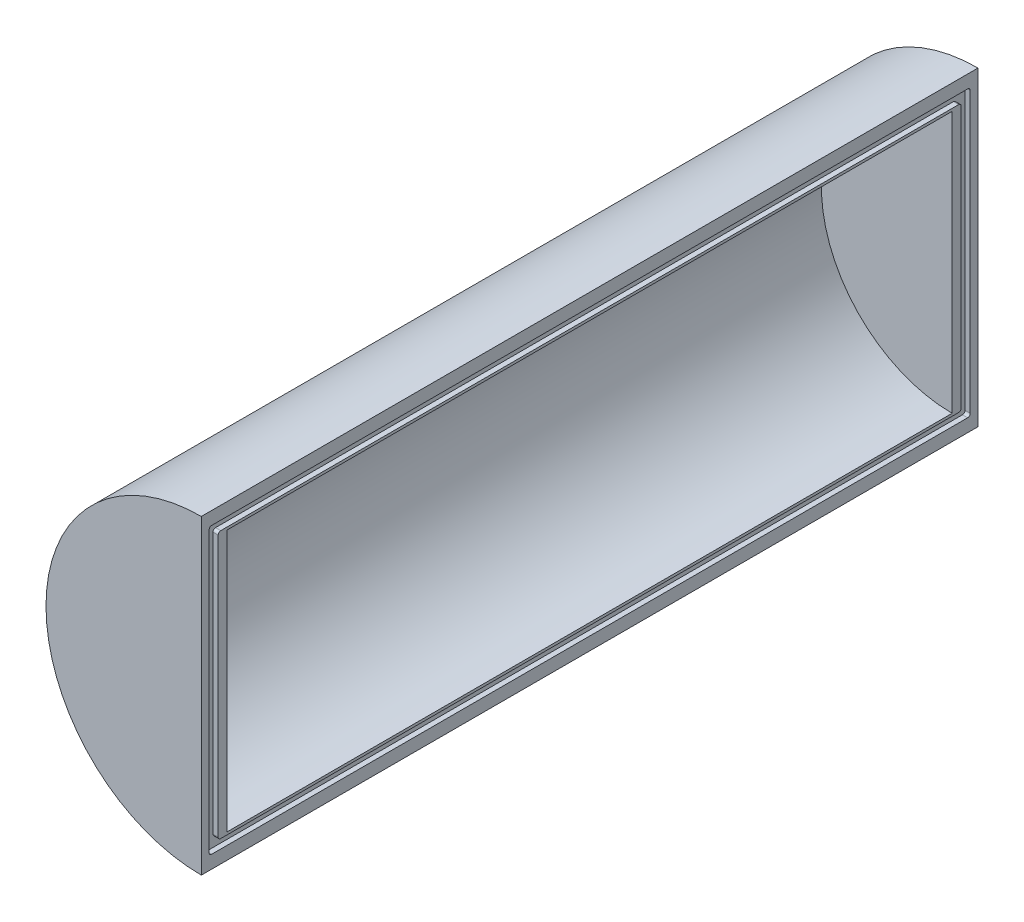
from build123d import *

# Parameters (mm, degrees)
BOSS_EXTRUDE1_DEPTH     = 280
BOSS_EXTRUDE3_START     = 10
BOSS_EXTRUDE3_DEPTH     = 10
CUT_EXTRUDE_THIN1_START = -2
CUT_EXTRUDE_THIN1_DEPTH = 2
FILLET6_R               = 1


# Read off the part's stored shape, not the designer's step: Cut-Extrude-Thin1
with BuildPart() as part:
    # Sketch1 → Boss-Extrude1 (new body)
    with BuildSketch(Plane.XY):
        with BuildLine():
            Line((0, 55), (-2, 55))
            Line((-2, 55), (-2, 51.5))
            Line((-2, 51.5), (0, 51.5))
            Line((0, 51.5), (0, 50.5))
            ThreePointArc((0, 50.5), (-50.5, 0), (0, -50.5))
            Line((0, -50.5), (0, -51.5))
            Line((0, -51.5), (-2, -51.5))
            Line((-2, -51.5), (-2, -55))
            Line((-2, -55), (0, -55))
            Line((0, -55), (0, -60))
            ThreePointArc((0, -60), (-60, 0), (0, 60))
            Line((0, 60), (0, 55))
        make_face()
    extrude(amount=-BOSS_EXTRUDE1_DEPTH)

    # Sketch7 → Boss-Extrude3 (add)
    with BuildSketch(Plane.XY.offset(BOSS_EXTRUDE3_START)):
        with BuildLine():
            Line((0, 60), (0, -60))
            ThreePointArc((0, -60), (-60, 0), (0, 60))
        make_face()
    boss_extrude3 = extrude(amount=-BOSS_EXTRUDE3_DEPTH)

    # Mirror1: Boss-Extrude3 across plane
    add(boss_extrude3.mirror(Plane.XY.offset(-140)))

    # Cut-Extrude-Thin1 outline → Cut-Extrude-Thin1 (cut)
    with BuildSketch(Plane(origin=(0, 0, 0), x_dir=(0, 0, -1), z_dir=(1, 0, 0)).offset(CUT_EXTRUDE_THIN1_START)):
        Polygon((0, 55), (-7, 55), (-7, -55), (0, -55), (0, -51.5), (-3.5, -51.5), (-3.5, 51.5), (0, 51.5), align=None)
    cut_extrude_thin1 = extrude(amount=CUT_EXTRUDE_THIN1_DEPTH, mode=Mode.SUBTRACT)

    # Mirror2: Cut-Extrude-Thin1 across plane
    add(cut_extrude_thin1.mirror(Plane.XY.offset(-140)), mode=Mode.SUBTRACT)

    # Fillet6
    fillet6_edges = [part.edges().sort_by_distance(p)[0] for p in [
        (-1, -55, 7),
        (-1, 55, 7),
        (-1, 51.5, 3.5),
        (-1, -51.5, 3.5),
        (-1, -55, -287),
        (-1, -51.5, -283.5),
        (-1, 51.5, -283.5),
        (-1, 55, -287),
    ]]
    fillet(fillet6_edges, radius=FILLET6_R)


solid = part.part
